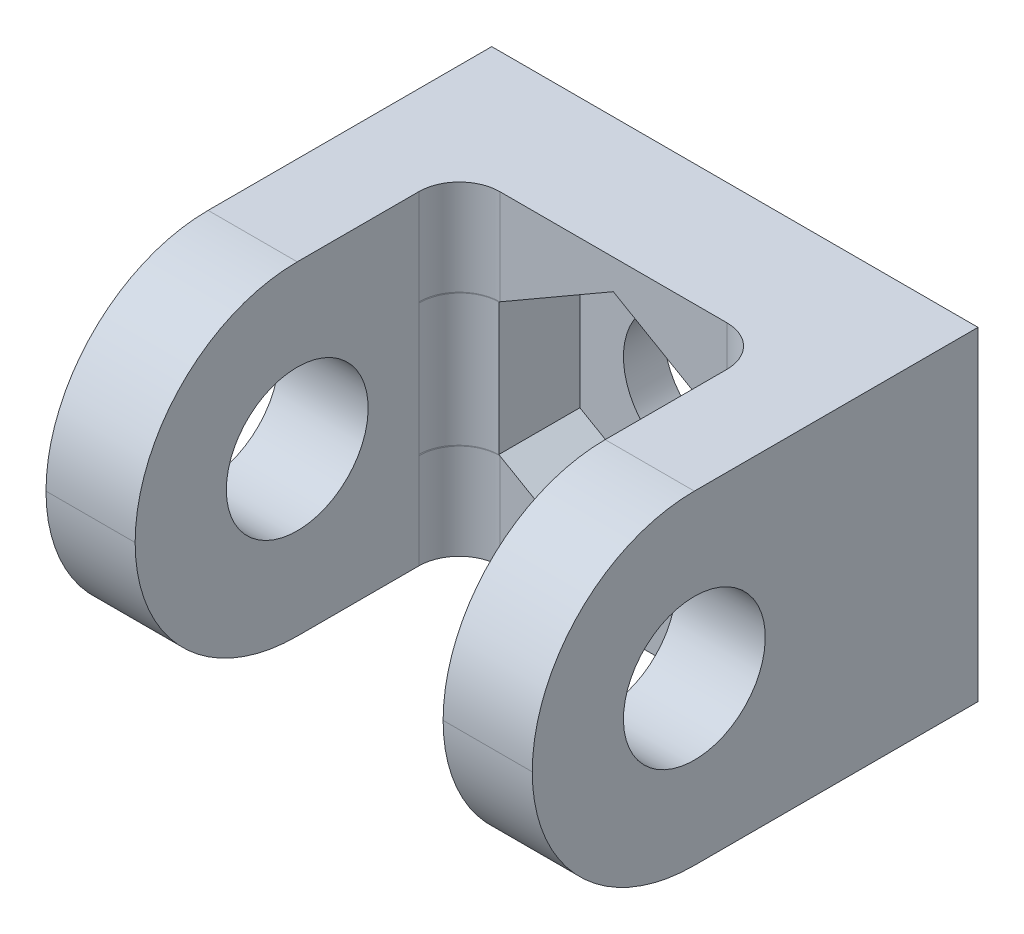
from build123d import *

# Parameters (mm, degrees)
SKETCH_1_W          = 12
SKETCH_1_H          = 8
EXTRUDE_1_DEPTH     = 3
CUT_EXTRUDE_1_DEPTH = 2
SKETCH_3_R          = 1.75
CUT_EXTRUDE_2_DEPTH = 2
SKETCH_4_W          = 2.2
SKETCH_4_H          = 8
EXTRUDE_2_DEPTH     = 8
FILLET_1_R          = 4
SKETCH_5_R          = 1.75
CUT_EXTRUDE_3_DEPTH = 17.763054614
FILLET_2_R          = 1


with BuildPart() as part:
    # Эскиз1 → Бобышка-Вытянуть1 (new body)
    with BuildSketch(Plane.XY):
        Rectangle(SKETCH_1_W, SKETCH_1_H)
    extrude(amount=EXTRUDE_1_DEPTH)

    # Эскиз2 → Вырез-Вытянуть1 (cut)
    with BuildSketch(Plane.XY.offset(3)):
        Polygon((2.825, -1.63101451), (2.825, 1.63101451), (0, 3.262029021), (-2.825, 1.63101451), (-2.825, -1.63101451), (0, -3.262029021), align=None)
    extrude(amount=-CUT_EXTRUDE_1_DEPTH, mode=Mode.SUBTRACT)

    # Эскиз3 → Вырез-Вытянуть2 (cut)
    with BuildSketch(Plane.XY.offset(1)):
        Circle(SKETCH_3_R)
    extrude(amount=-CUT_EXTRUDE_2_DEPTH, mode=Mode.SUBTRACT)

    # Эскиз4 → Бобышка-Вытянуть2 (add)
    with BuildSketch(Plane.XY.offset(3)):
        with Locations((-4.9, 0)):
            Rectangle(SKETCH_4_W, SKETCH_4_H)
        with Locations((4.9, 0)):
            Rectangle(SKETCH_4_W, SKETCH_4_H)
    extrude(amount=EXTRUDE_2_DEPTH)

    # Скругление1
    fillet_1_edges = [part.edges().sort_by_distance(p)[0] for p in [
        (4.9, 4, 11),
        (-4.9, 4, 11),
        (4.9, -4, 11),
        (-4.9, -4, 11),
    ]]
    fillet(fillet_1_edges, radius=FILLET_1_R - 0.0001)  # a hair under: the kernel refuses the full size

    # Эскиз5 → Вырез-Вытянуть3 (cut, through all)
    with BuildSketch(Plane(origin=(6, 0, 0), x_dir=(0, 0, -1), z_dir=(1, 0, 0))):
        with Locations(Location((-7, 0, 0), (0, 0, 90))):
            Circle(SKETCH_5_R)
    extrude(amount=-CUT_EXTRUDE_3_DEPTH, mode=Mode.SUBTRACT)

    # Скругление2
    fillet_2_edges = [part.edges().sort_by_distance(p)[0] for p in [
        (-3.8, 0, 3),
        (3.8, 0, 3),
    ]]
    fillet(fillet_2_edges, radius=FILLET_2_R)


solid = part.part
